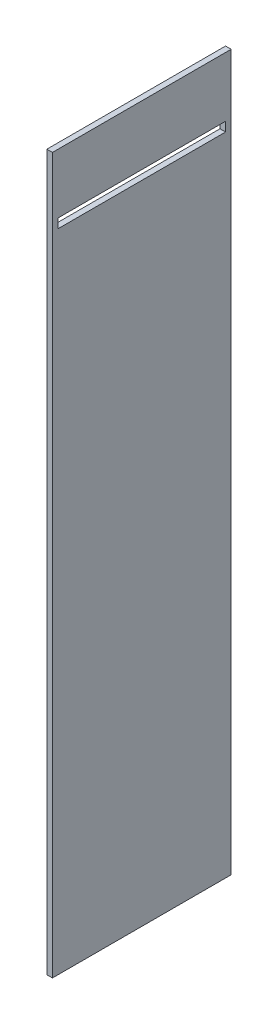
from build123d import *

# Parameters (mm, degrees)
SKETCH1_W           = 4.7625
SKETCH1_H           = 152.4
BOSS_EXTRUDE1_DEPTH = 609.6
SKETCH2_W           = 142.875
SKETCH2_H           = 7.9375
CUT_EXTRUDE1_DEPTH  = 629.379345146


with BuildPart() as part:
    # Sketch1 → Boss-Extrude1 (new body)
    with BuildSketch(Plane(origin=(0, 0, 0), x_dir=(1, 0, 0), z_dir=(0, 1, 0))):
        with Locations((2.38125, 76.2)):
            Rectangle(SKETCH1_W, SKETCH1_H)
    extrude(amount=BOSS_EXTRUDE1_DEPTH)

    # Sketch2 → Cut-Extrude1 (cut, through all)
    with BuildSketch(Plane(origin=(4.7625, 0, 0), x_dir=(0, 0, -1), z_dir=(1, 0, 0))):
        with Locations((76.2, 554.83125)):
            Rectangle(SKETCH2_W, SKETCH2_H)
    extrude(amount=-CUT_EXTRUDE1_DEPTH, mode=Mode.SUBTRACT)


solid = part.part
